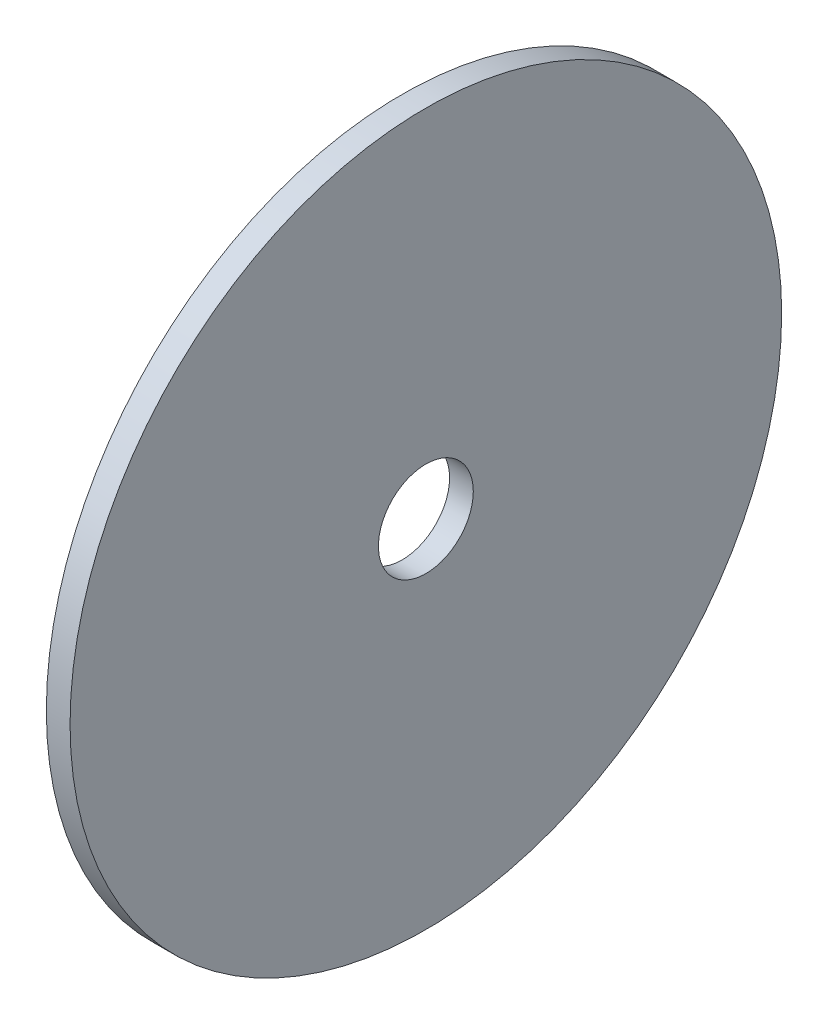
from build123d import *

# Parameters (mm, degrees)
CROQUIS1_R              = 15
CROQUIS1_R_2            = 2
SALIENTE_EXTRUIR1_DEPTH = 1


with BuildPart() as part:
    # Croquis1 → Saliente-Extruir1 (new body)
    with BuildSketch(Plane(origin=(0, 0, 0), x_dir=(0, 0, -1), z_dir=(1, 0, 0))):
        Circle(CROQUIS1_R)
        Circle(CROQUIS1_R_2, mode=Mode.SUBTRACT)
    extrude(amount=SALIENTE_EXTRUIR1_DEPTH)


solid = part.part
